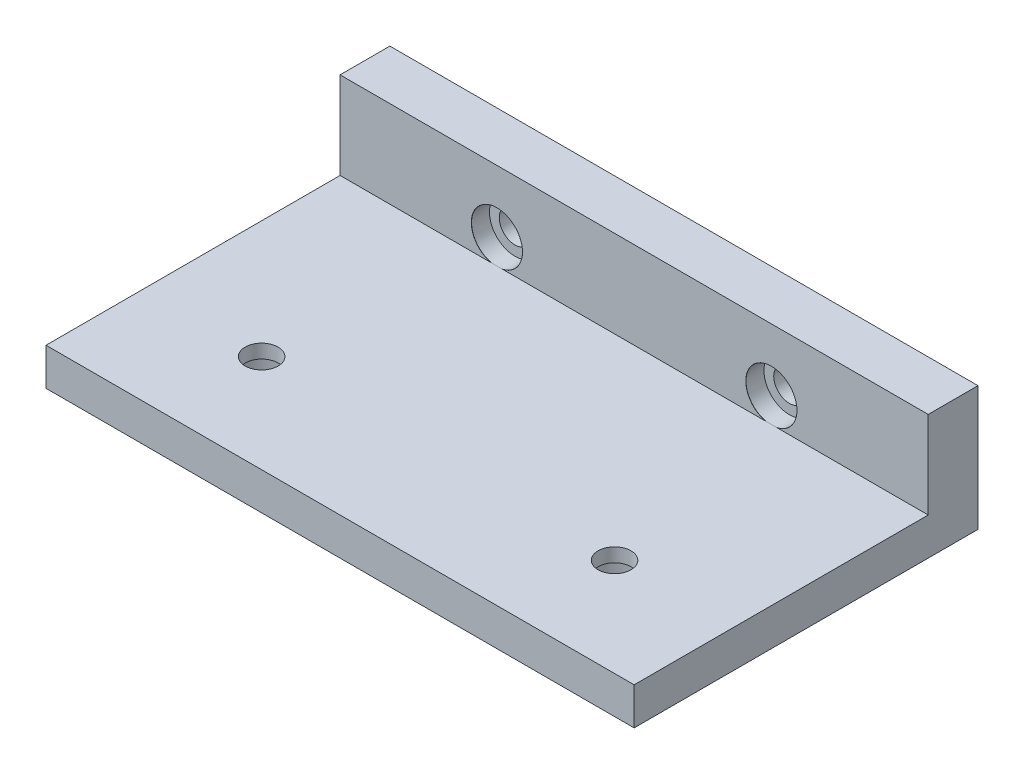
from build123d import *

# Parameters (mm, degrees)
ESBO_O1_W                                    = 150
ESBO_O1_H                                    = 31.75
RESSALTO_EXTRUS_O1_DEPTH                     = 12.7
ESBO_O2_W                                    = 150
ESBO_O2_H                                    = 9.525
RESSALTO_EXTRUS_O2_DEPTH                     = 75
ESBO_O4_R                                    = 4
CORTE_EXTRUS_O1_DEPTH                        = 117.483070122
REBAIXO_PARA_PARAFUSO_COM_CABE_A_PAN_2_COUNT = 2
REBAIXO_PARA_PARAFUSO_COM_CABE_A_PAN_2_PITCH = 70
ESBO_O7_R                                    = 3
CORTE_EXTRUS_O2_DEPTH                        = 9.525


# Read off the part's stored shape, not the designer's step: Rebaixo para parafuso com cabeça panela de M81
with BuildPart() as part:
    # Esboço1 → Ressalto-extrusão1 (new body)
    with BuildSketch(Plane.XY):
        Rectangle(ESBO_O1_W, ESBO_O1_H)
    extrude(amount=RESSALTO_EXTRUS_O1_DEPTH)

    # Esboço2 → Ressalto-extrusão2 (add)
    with BuildSketch(Plane.XY.offset(12.7)):
        with Locations((0, -11.1125)):
            Rectangle(ESBO_O2_W, ESBO_O2_H)
    extrude(amount=RESSALTO_EXTRUS_O2_DEPTH)

    # Esboço4 → Corte-extrusão1 (cut, through all)
    with BuildSketch(Plane(origin=(0, 0, 0), x_dir=(-1, 0, 0), z_dir=(0, 0, -1))):
        with Locations((-35, 0)):
            Circle(ESBO_O4_R)
        with Locations((35, 0)):
            Circle(ESBO_O4_R)
    extrude(amount=-CORTE_EXTRUS_O1_DEPTH, mode=Mode.SUBTRACT)

    # Esboço6 → Rebaixo para parafuso com cabe_a panela (revolve, cut)
    with BuildSketch(Plane(origin=(-35, 0, 12.7), x_dir=(0, -1, 0), z_dir=(1, 0, 0))):
        Polygon((0, 0), (0, 12.7), (3.3, 12.7), (3.3, 4.6), (6.5, 4.6), (6.5, 0.025), (6.525, 0), align=None)
    rebaixo_para_parafuso_com_cabe_a_panela = revolve(axis=Axis((-35, 0, 19.05), (0, 0, -1)), mode=Mode.SUBTRACT)

    # Rebaixo para parafuso com cabe_a pan 2: Rebaixo para parafuso com cabe_a panela ×2
    with Locations(*[(i * REBAIXO_PARA_PARAFUSO_COM_CABE_A_PAN_2_PITCH, 0, 0) for i in range(1, REBAIXO_PARA_PARAFUSO_COM_CABE_A_PAN_2_COUNT)]):
        add(rebaixo_para_parafuso_com_cabe_a_panela, mode=Mode.SUBTRACT)

    # Esboço7 → Corte-extrusão2 (cut)
    with BuildSketch(Plane.XZ.offset(15.875)):
        with Locations((-45, 62.7)):
            Circle(ESBO_O7_R)
        with Locations((45, 62.7)):
            Circle(ESBO_O7_R)
    extrude(amount=-CORTE_EXTRUS_O2_DEPTH, mode=Mode.SUBTRACT)

    # Rebaixo para parafuso com cabe_a pan 3 o → Rebaixo para parafuso com cabe_a pan 3 (revolve, cut)
    with BuildSketch(Plane(origin=(45, 0, 62.7), x_dir=(1, 0, 0), z_dir=(0, 0, 1))):
        Polygon((4.2, -9.875), (4.2, -6.35), (3, -6.35), (3, -15.875), (9.025, -15.875), (9, -15.85), (9, -9.875), align=None)
    revolve(axis=Axis((45, 0, 62.7), (0, 1, 0)), mode=Mode.SUBTRACT)

    # Rebaixo para parafuso com cabe_a pan 4 → Rebaixo para parafuso com cabe_a pan 3 2 (revolve, cut)
    with BuildSketch(Plane(origin=(-45, 0, 62.7), x_dir=(1, 0, 0), z_dir=(0, 0, 1))):
        Polygon((3, -15.875), (9.025, -15.875), (9, -15.85), (9, -9.875), (4.2, -9.875), (4.2, -6.35), (3, -6.35), align=None)
    revolve(axis=Axis((-45, 0, 62.7), (0, 1, 0)), mode=Mode.SUBTRACT)


solid = part.part
